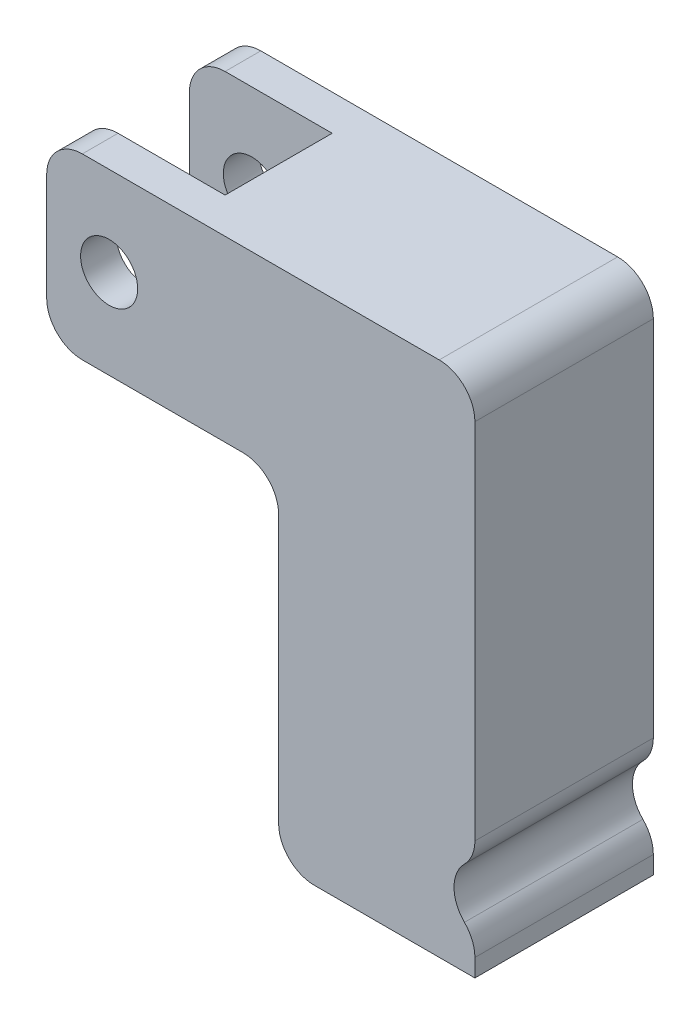
from build123d import *

# Parameters (mm, degrees)
BOSS_EXTRUDE1_DEPTH = 5
SKETCH4_R           = 0.8
CUT_EXTRUDE3_DEPTH  = 20.474342094
SKETCH5_W           = 4
SKETCH5_H           = 3
CUT_EXTRUDE4_DEPTH  = 13
FILLET4_R           = 1
CUT_EXTRUDE5_DEPTH  = 20.474342094
FILLET6_R           = 1
CUT_EXTRUDE6_START  = -8.5
CUT_EXTRUDE6_DEPTH  = 8.037702488
SKETCH11_W          = 3
SKETCH11_H          = 5
CUT_EXTRUDE8_DEPTH  = 4
SKETCH12_R          = 0.6
CUT_EXTRUDE9_DEPTH  = 5
CUT_EXTRUDE10_REACH = 21.474
SKETCH9_R           = 0.25


# Read off the part's stored shape, not the designer's step: Cut-Extrude6
with BuildPart() as part:
    # Sketch1 → Boss-Extrude1 (new body)
    with BuildSketch(Plane.XY):
        Polygon((0, 0), (12, 0), (12, -14.5), (6.5, -14.5), (6.5, -5), (0, -5), align=None)
    extrude(amount=BOSS_EXTRUDE1_DEPTH)

    # Sketch4 → Cut-Extrude3 (cut, through all)
    with BuildSketch(Plane.XY.offset(5)):
        with Locations((1.75, -2.5)):
            Circle(SKETCH4_R)
    extrude(amount=-CUT_EXTRUDE3_DEPTH, mode=Mode.SUBTRACT)

    # Sketch5 → Cut-Extrude4 (cut)
    with BuildSketch(Plane(origin=(0, 0, 0), x_dir=(1, 0, 0), z_dir=(0, 1, 0))):
        with Locations((2, -2.5)):
            Rectangle(SKETCH5_W, SKETCH5_H)
    extrude(amount=-CUT_EXTRUDE4_DEPTH, mode=Mode.SUBTRACT)

    # Fillet4
    fillet4_edges = [part.edges().sort_by_distance(p)[0] for p in [
        (0, 0, 4.5),
        (0, -5, 4.5),
        (0, 0, 0.5),
        (0, -5, 0.5),
    ]]
    fillet(fillet4_edges, radius=FILLET4_R)

    # Sketch6 → Cut-Extrude5 (cut, through all)
    with BuildSketch(Plane.XY.offset(5)):
        Polygon((12, -13.588182425), (11, -12.588182425), (12, -11.588182425), align=None)
    extrude(amount=-CUT_EXTRUDE5_DEPTH, mode=Mode.SUBTRACT)

    # Fillet6
    fillet6_edges = [part.edges().sort_by_distance(p)[0] for p in [
        (11, -12.588182425, 2.5),
        (12, -13.588182425, 2.5),
        (12, -11.588182425, 2.5),
        (6.5, -5, 2.5),
        (6.5, -14.5, 2.5),
        (12, 0, 2.5),
    ]]
    fillet(fillet6_edges, radius=FILLET6_R - 0.0001)  # a hair under: the kernel refuses the full size

    # Cut-Extrude6 outline → Cut-Extrude6 (cut)
    with BuildSketch(Plane.XZ.offset(14.5).offset(CUT_EXTRUDE6_START)):
        with BuildLine():
            Line((6.499992217, 5.000061772), (6.49999198, -6.3653e-05))
            ThreePointArc((6.49999198, -6.3653e-05), (6.656865167, 2.499999052), (6.499992217, 5.000061772))
        make_face()
    extrude(amount=CUT_EXTRUDE6_DEPTH, mode=Mode.SUBTRACT)

    # Sketch11 → Cut-Extrude8 (cut, along a direction that is not the sketch's normal)
    with BuildSketch(Plane.ZY.offset(-4)):
        with Locations((2.5, -2.5)):
            Rectangle(SKETCH11_W, SKETCH11_H)
    extrude(amount=-CUT_EXTRUDE8_DEPTH, dir=(-0.8191736087025463, 0.5735456379445732, 0), mode=Mode.SUBTRACT)

    # Sketch12 → Cut-Extrude9 (cut, along a direction that is not the sketch's normal)
    with BuildSketch(Plane.ZY.offset(-6.5)):
        with Locations((3.671694189, -8.375443102)):
            Circle(SKETCH12_R)
        with Locations((3.671694189, -10.194652501)):
            Circle(SKETCH12_R)
        with Locations((3.671694189, -12.168032187)):
            Circle(SKETCH12_R)
    extrude(amount=-CUT_EXTRUDE9_DEPTH, dir=(-0.8191736087025463, 0.5735456379445732, 0), mode=Mode.SUBTRACT)

    # Cut-Extrude10: up to this plane
    cut_extrude10_end = Plane(origin=(7.276694435, -7.294182552, 1), z_dir=(-0.5735456379445732, -0.8191736087025463, 0))
    # Sketch9 → Cut-Extrude10 (cut, up to the surface)
    with BuildSketch(Plane.XZ.offset(14.5), mode=Mode.PRIVATE) as cut_extrude10_sk1:
        with Locations((6.656865167, 2.5)):
            Circle(SKETCH9_R)
    cut_extrude10_tool1 = split(extrude(cut_extrude10_sk1.sketch, amount=-CUT_EXTRUDE10_REACH, mode=Mode.PRIVATE), bisect_by=cut_extrude10_end, keep=Keep.BOTH, mode=Mode.PRIVATE)
    add(cut_extrude10_tool1.solids().sort_by_distance((6.656865, -14.5, 2.5))[0], mode=Mode.SUBTRACT)


solid = part.part
